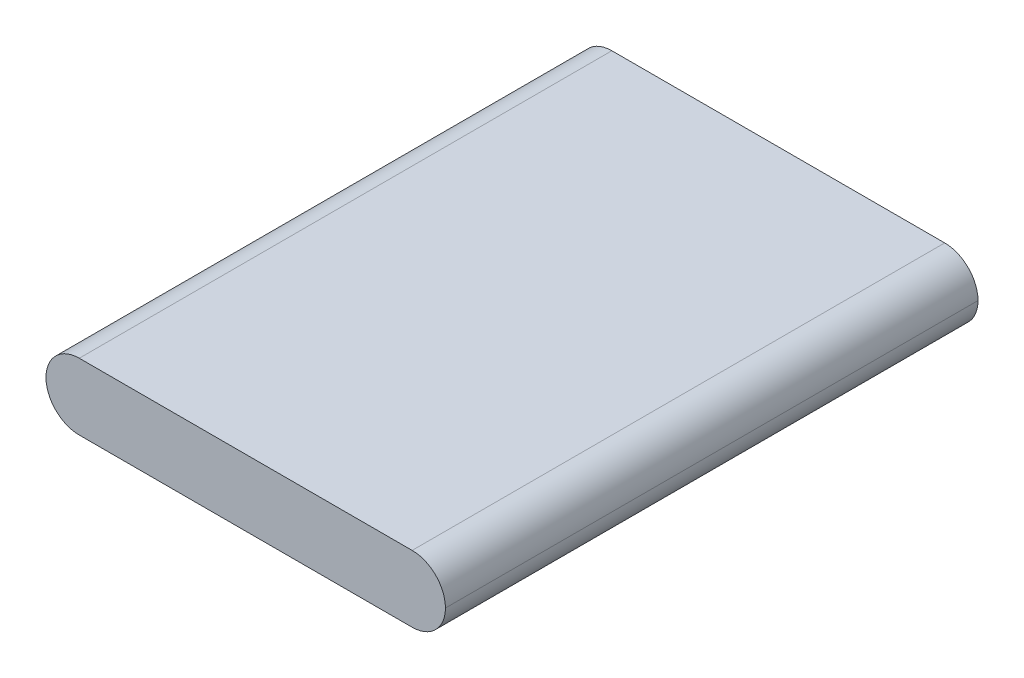
from build123d import *

# Parameters (mm, degrees)
SKETCH1_W      = 30
SKETCH1_H      = 40
EXTRUDE1_DEPTH = 2.5
FILLET1_R      = 2.5


with BuildPart() as part:
    # Sketch1 → Extrude1 (new, symmetric)
    with BuildSketch(Plane(origin=(0, 0, 0), x_dir=(1, 0, 0), z_dir=(0, 1, 0))):
        Rectangle(SKETCH1_W, SKETCH1_H)
    extrude(amount=EXTRUDE1_DEPTH, both=True)

    # Fillet1
    fillet1_edges = [part.edges().sort_by_distance(p)[0] for p in [
        (15, -2.5, 0),
        (15, 2.5, 0),
        (-15, -2.5, 0),
        (-15, 2.5, 0),
    ]]
    fillet(fillet1_edges, radius=FILLET1_R - 0.0001)  # a hair under: the kernel refuses the full size


solid = part.part
